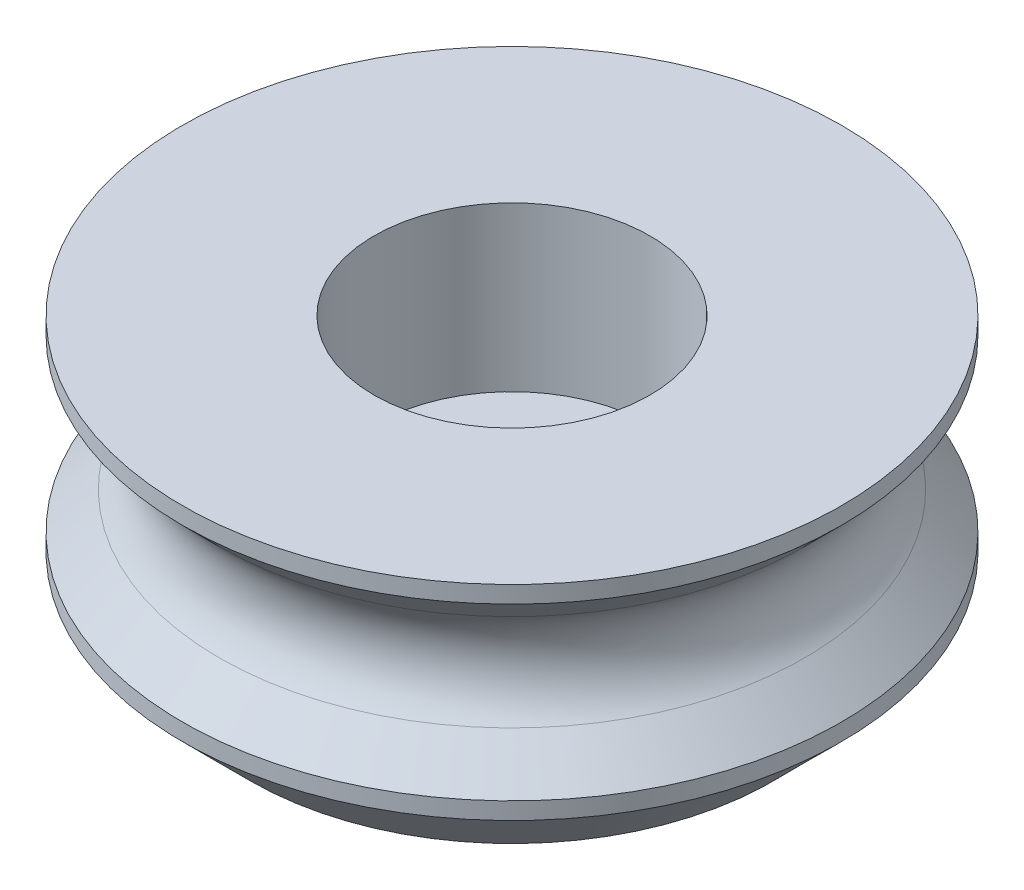
from build123d import *

# Parameters (mm, degrees)
FILLET1_R              = 2
MOVE_FACE1_BY          = 2
MOVE_FACE4_BY          = 1.8
MOVE_START             = 1.2
MOVE_FACE3_OUTLINE_R   = 4.05
MOVE_FACE3_OUTLINE_R_2 = 4
MOVE_FACE3_DEPTH       = 4.8
CHAMFER1_SIZE          = 2


# Read off the part's stored shape, not the designer's step: Move Face3
with BuildPart() as part:
    # Sketch2 → Revolve1 (revolve)
    with BuildSketch(Plane.XY, mode=Mode.PRIVATE) as revolve1_sk:
        Polygon((2.6, 0), (2.6, 3), (4, 3), (4, 6), (9.671572875, 6), (9.671572875, 5.5), (7.171572875, 3), (9.671572875, 0.5), (9.671572875, 0), align=None)
    revolve(revolve1_sk.sketch.rotate(Axis((0, 0, 0), (0, 1, 0)), 90), axis=Axis((0, 0, 0), (0, 1, 0)))

    # Fillet1
    fillet1_edges = [part.edges().sort_by_distance(p)[0] for p in [
        (0, 3, 7.171572875),
    ]]
    fillet(fillet1_edges, radius=FILLET1_R)

    # Move Face1: a face moved outward by 2.0
    extrude(part.faces().sort_by_distance((4.835786438, 0, 0))[0], amount=MOVE_FACE1_BY, dir=(0, -1, 0))

    # Move Face4: a face moved inward by 1.8
    extrude(part.faces().sort_by_distance((3.2, 3, 0))[0], amount=MOVE_FACE4_BY, dir=(0, -1, 0), mode=Mode.SUBTRACT)

    # Move Face3 outline → Move Face3 (cut)
    with BuildSketch(Plane(origin=(0, 0, 0), x_dir=(1, 0, 0), z_dir=(0, 1, 0)).offset(MOVE_START)):
        Circle(MOVE_FACE3_OUTLINE_R)
        Circle(MOVE_FACE3_OUTLINE_R_2, mode=Mode.SUBTRACT)
    extrude(amount=MOVE_FACE3_DEPTH, mode=Mode.SUBTRACT)

    # Chamfer1
    chamfer1_edges = [part.edges().sort_by_distance(p)[0] for p in [
        (0, -2, 9.671572875),
    ]]
    chamfer(chamfer1_edges, length=CHAMFER1_SIZE - 0.0001)  # a hair under: the kernel refuses the full size


solid = part.part
